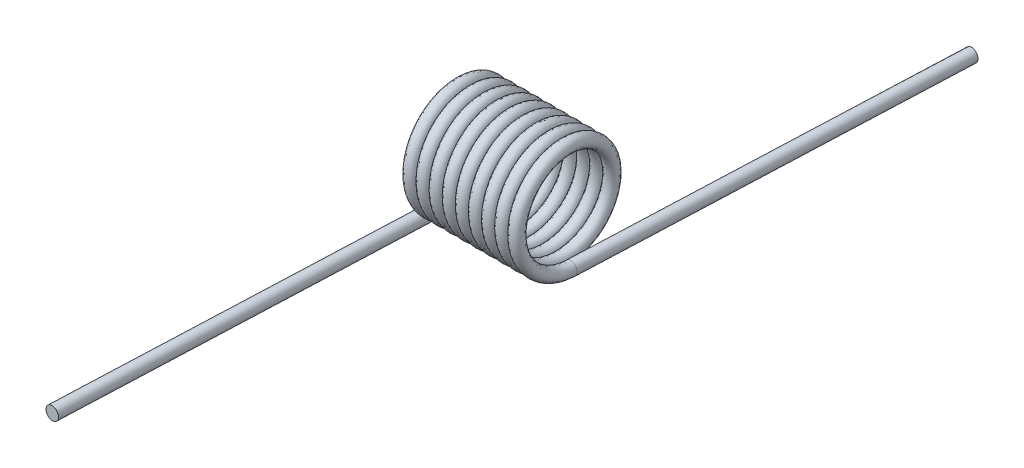
from build123d import *

# Parameters (mm, degrees)
SWEEP1_PITCH   = 3.4544
SKETCH4_R      = 1.7145
EXTRUDE1_DEPTH = 101.6
SKETCH5_R      = 1.7145
EXTRUDE2_DEPTH = 101.6


with BuildPart() as part:
    # Sweep1: the profile of Sketch3 screwed along a right-hand helix of 9 turns, 6 arcs to a turn; built about Z, then put on its axis
    sweep1_z = Axis((0, 0, 0), (0, 0, 1))
    sweep1_corners = [(13.425638343, -0.070340044, 1.71259319), (15.099837093, 0.001634872, -0.039804784), (13.345961657, 0.070340044, -1.71259319), (11.671762907, -0.001634872, 0.039804784)]
    with BuildLine(mode=Mode.PRIVATE) as sweep1_profile:
        ThreePointArc((13.425638343, -0.070340044, 1.71259319), (14.625977214, -0.048581893, 1.182840026), (15.099837093, 0.001634872, -0.039804784))
        ThreePointArc((15.099837093, 0.001634872, -0.039804784), (14.569637289, 0.050893951, -1.23913249), (13.345961657, 0.070340044, -1.71259319))
        ThreePointArc((13.345961657, 0.070340044, -1.71259319), (12.145622786, 0.048581893, -1.182840026), (11.671762907, -0.001634872, 0.039804784))
        ThreePointArc((11.671762907, -0.001634872, 0.039804784), (12.201962711, -0.050893951, 1.23913249), (13.425638343, -0.070340044, 1.71259319))
    sweep1_cap = Face(sweep1_profile.wire())
    sweep1_arcs = [((13.425638343, -0.070340044, 1.71259319), (15.139675436, -0.068705173, 1.672788406), (15.099837093, 0.001634872, -0.039804784), (1, 0.7071067811865476, 1)), ((15.099837093, 0.001634872, -0.039804784), (15.05999875, 0.071974916, -1.752397974), (13.345961657, 0.070340044, -1.71259319), (1, 0.7071067811865476, 1)), ((13.345961657, 0.070340044, -1.71259319), (11.631924564, 0.068705173, -1.672788406), (11.671762907, -0.001634872, 0.039804784), (1, 0.7071067811865476, 1)), ((11.671762907, -0.001634872, 0.039804784), (11.71160125, -0.071974916, 1.752397974), (13.425638343, -0.070340044, 1.71259319), (1, 0.7071067811865476, 1))]  # start, shoulder, end, weights
    sweep1_turn_angles = [0, 30, 60, 90, 120, 150, 180, 210, 240, 270, 300, 330, 360]
    sweep1_turn_weights = [1, 0.8660254037844387, 1, 0.8660254037844387, 1, 0.8660254037844387, 1, 0.8660254037844387, 1, 0.8660254037844387, 1, 0.8660254037844387, 1]
    sweep1_turn_sides = [Face.make_bezier_surface([[Vector(p[j][0], p[j][1], 0).rotate(sweep1_z, sweep1_turn_angles[2 * i + k]) / sweep1_turn_weights[2 * i + k] + Vector(0, 0, p[j][2] + SWEEP1_PITCH * sweep1_turn_angles[2 * i + k] / 360) for k in range(3)] for j in range(3)], [[p[3][j] * sweep1_turn_weights[2 * i + k] for k in range(3)] for j in range(3)]) for p in sweep1_arcs for i in range(6)]
    sweep1 = Plane(origin=(0, 0, 0), x_dir=(0, -1, 0), z_dir=(1, 0, 0)) * Solid(Shell([*[p.moved(Location((0, 0, SWEEP1_PITCH * i))) for i in range(9) for p in sweep1_turn_sides], sweep1_cap, sweep1_cap.rotate(sweep1_z, 3240).moved(Location((0, 0, SWEEP1_PITCH * 3240 / 360)))]))
    add(sweep1)

    # Sketch4 → Extrude1 (add)
    with BuildSketch(Plane(origin=(0, 0, 0), x_dir=(-0.9988878332101474, 0.023236129092748657, -0.04102656419348297), z_dir=(-0.041037644164380355, -1.0023882765497483e-14, 0.9991576010627341))):
        with Locations(Location((-0.311034177, 13.382185897, 0), (0, 0, 181.33145196))):
            Circle(SKETCH4_R)
    extrude(amount=EXTRUDE1_DEPTH)

    # Sketch5 → Extrude2 (add)
    with BuildSketch(Plane(origin=(0.05235763, 0, -1.274769172), x_dir=(-0.9983153130732385, -0.0410522303243225, -0.041003049507086824), z_dir=(0.041037644164380355, 1.4269293212298972e-13, -0.9991576010627341))):
        with Locations(Location((-30.487706813, -14.649738064, 0), (0, 0, 2.352780704))):
            Circle(SKETCH5_R)
    extrude(amount=EXTRUDE2_DEPTH)


solid = part.part
